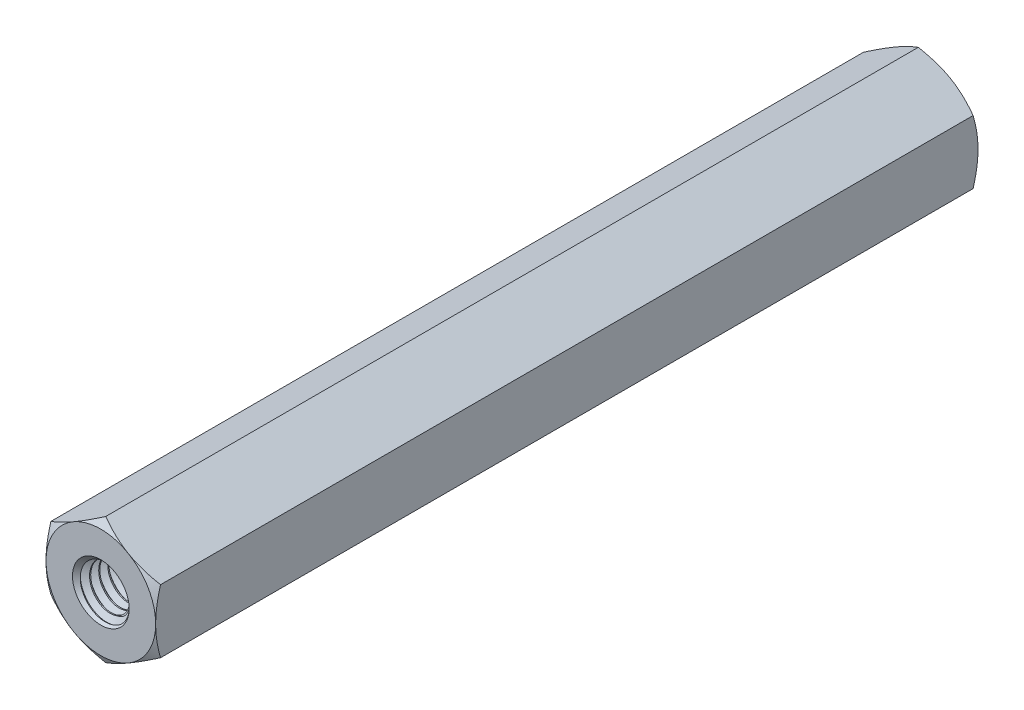
from build123d import *

# Parameters (mm, degrees)
EXTRUDE1_DEPTH          = 22.5
EXTRUDE1_DEPTH_BACK     = 22.5
SKETCH1_R               = 1.5
SWEEP1_PITCH            = 0.5
EXTRUDE2_DEPTH          = 46.730531747
SKETCH8_OUTSIDE_W       = 179.162
SKETCH8_OUTSIDE_H       = 180.09
SKETCH8_OUTSIDE_R       = 3
EXTRUDE4_DEPTH          = 46.730531747
EXTRUDE4_DRAFT          = -60
MIRROR1_COPY_1_SKETCH_W = 179.162
MIRROR1_COPY_1_SKETCH_H = 180.09
MIRROR1_COPY_1_SKETCH_R = 3
MIRROR1_COPY_1_DEPTH    = 46.730531747
MIRROR1_COPY_1_DRAFT    = -60
SKETCH9_W               = 32.4
SKETCH9_H               = 1.5508


with BuildPart() as part:
    # Sketch1 → Extrude1 (new, two sides: drawn at the far end of the back side and taken through both)
    with BuildSketch(Plane.XY.offset(-EXTRUDE1_DEPTH_BACK)):
        Polygon((0, 3.464101615), (-3, 1.732050808), (-3, -1.732050808), (0, -3.464101615), (3, -1.732050808), (3, 1.732050808), align=None)
        with Locations(Location((0, 0, 0), (0, 0, 180))):
            Circle(SKETCH1_R, mode=Mode.SUBTRACT)
    extrude(amount=EXTRUDE1_DEPTH + EXTRUDE1_DEPTH_BACK)

    # Sweep1: arcs per turn and ends read off the stored shape
    # Sweep1: the profile of Sketch12 profile screwed along a right-hand helix through 91 turns, 6 arcs to a turn; built about Z, then put on its axis
    sweep1_z = Axis((0, 0, 0), (0, 0, 1))
    sweep1_corners = [(1.5006, 0, -0.43784641), (1.5006, 0, 0.00034641), (1.175240474, 0, -0.1875), (1.175240474, 0, -0.25)]
    with BuildLine(mode=Mode.PRIVATE) as sweep1_profile:
        Line(sweep1_corners[0], sweep1_corners[1])
        Line(sweep1_corners[1], sweep1_corners[2])
        Line(sweep1_corners[2], sweep1_corners[3])
        Line(sweep1_corners[3], sweep1_corners[0])
    sweep1_cap = Face(sweep1_profile.wire())
    sweep1_turn_angles = [0, 30, 60, 90, 120, 150, 180, 210, 240, 270, 300, 330, 360]
    sweep1_turn_weights = [1, 0.8660254037844387, 1, 0.8660254037844387, 1, 0.8660254037844387, 1, 0.8660254037844387, 1, 0.8660254037844387, 1, 0.8660254037844387, 1]
    sweep1_turn_rails = [Edge.make_bspline([Vector(p[0], p[1], 0).rotate(sweep1_z, sweep1_turn_angles[k]) / sweep1_turn_weights[k] + Vector(0, 0, p[2] + SWEEP1_PITCH * sweep1_turn_angles[k] / 360) for k in range(13)], [0, 0, 0, 1, 1, 2, 2, 3, 3, 4, 4, 5, 5, 6, 6, 6], 2, sweep1_turn_weights) for p in sweep1_corners]
    sweep1_turn_sides = [Face.make_surface_from_curves(sweep1_turn_rails[p[0]], sweep1_turn_rails[p[1]]) for p in [(0, 1), (1, 2), (2, 3), (3, 0)]]
    sweep1 = Plane(origin=(0, 0, -22.5), x_dir=(0, 1, 0), z_dir=(0, 0, 1)) * Solid(Shell([*[p.moved(Location((0, 0, SWEEP1_PITCH * i))) for i in range(91) for p in sweep1_turn_sides], sweep1_cap, sweep1_cap.rotate(sweep1_z, 32760).moved(Location((0, 0, SWEEP1_PITCH * 32760 / 360)))]))
    add(sweep1)

    # Sketch6 → Extrude2 (cut, through all)
    with BuildSketch(Plane(origin=(0, 0, -22.5), x_dir=(-1, 0, 0), z_dir=(0, 0, -1))):
        Polygon((0, 3.464101615), (-3, 1.732050808), (-3, -1.732050808), (0, -3.464101615), (3, -1.732050808), (3, 1.732050808), align=None)
    extrude2 = extrude(amount=EXTRUDE2_DEPTH, mode=Mode.SUBTRACT)

    # Extrude3 cone 1 section (through the dimple's axis) → Extrude3 (revolve, cut)
    with BuildSketch(Plane(origin=(0, 0, -22.5), x_dir=(0, 1, 0), z_dir=(1, 0, 0))):
        Polygon((0, 0), (1.5508, 0), (0, 1.663029396), align=None)
    extrude3 = revolve(axis=Axis((0, 0, -22.5), (0, 0, 1)), mode=Mode.SUBTRACT)


with BuildPart() as extrude4_tool:
    # Sketch8 outside → Extrude4 (with draft: the straight prism first)
    with BuildSketch(Plane(origin=(0, 0, -22.5), x_dir=(-1, 0, 0), z_dir=(0, 0, -1))):
        Rectangle(SKETCH8_OUTSIDE_W, SKETCH8_OUTSIDE_H)
        Circle(SKETCH8_OUTSIDE_R, mode=Mode.SUBTRACT)
    extrude(amount=-EXTRUDE4_DEPTH)
    # Extrude4: the draft: its side faces are tilted about the plane it starts from
    extrude4_sides = [extrude4_tool.faces().sort_by_distance(p)[0] for p in [
        (0, -90.045, 0.865265873),
        (-89.581, 0, 0.865265873),
        (0, 90.045, 0.865265873),
        (89.581, 0, 0.865265873),
        (3, 0, 0.865265873),
    ]]
    draft(extrude4_sides, Plane(origin=(0, 0, -22.5), x_dir=(-1, 0, 0), z_dir=(0, 0, -1)), EXTRUDE4_DRAFT)


with BuildPart() as part_1:
    add(part.part)

    # Extrude4: cut by extrude4_tool
    add(extrude4_tool.part, mode=Mode.SUBTRACT)

    # Mirror1: Extrude2, Extrude3 across plane
    add(extrude2.mirror(Plane.XY), mode=Mode.SUBTRACT)
    add(extrude3.mirror(Plane.XY), mode=Mode.SUBTRACT)


with BuildPart() as mirror1_copy_1_tool:
    # Mirror1 copy 1 sketch → Mirror1 copy 1 (with draft: the straight prism first)
    with BuildSketch(Plane(origin=(0, 0, 22.5), x_dir=(-1, 0, 0), z_dir=(0, 0, 1))):
        Rectangle(MIRROR1_COPY_1_SKETCH_W, MIRROR1_COPY_1_SKETCH_H)
        Circle(MIRROR1_COPY_1_SKETCH_R, mode=Mode.SUBTRACT)
    extrude(amount=-MIRROR1_COPY_1_DEPTH)
    # Mirror1 copy 1: the draft: its side faces are tilted about the plane it starts from
    mirror1_copy_1_sides = [mirror1_copy_1_tool.faces().sort_by_distance(p)[0] for p in [
        (0, -90.045, -0.865265873),
        (-89.581, 0, -0.865265873),
        (0, 90.045, -0.865265873),
        (89.581, 0, -0.865265873),
        (3, 0, -0.865265873),
    ]]
    draft(mirror1_copy_1_sides, Plane(origin=(0, 0, 22.5), x_dir=(-1, 0, 0), z_dir=(0, 0, 1)), MIRROR1_COPY_1_DRAFT)


with BuildPart() as part_2:
    add(part_1.part)

    # Mirror1 copy 1: cut by mirror1_copy_1_tool
    add(mirror1_copy_1_tool.part, mode=Mode.SUBTRACT)

    # Sketch9 → Revolve 2 (revolve)
    with BuildSketch(Plane(origin=(0, 0, 0), x_dir=(0, 0, -1), z_dir=(1, 0, 0)), mode=Mode.PRIVATE) as revolve_2_sk:
        with Locations((0, 0.7754)):
            Rectangle(SKETCH9_W, SKETCH9_H)
    revolve(revolve_2_sk.sketch.rotate(Axis((0, 0, 22.5), (0, 0, -1)), 270), axis=Axis((0, 0, 22.5), (0, 0, -1)))


solid = part_2.part
